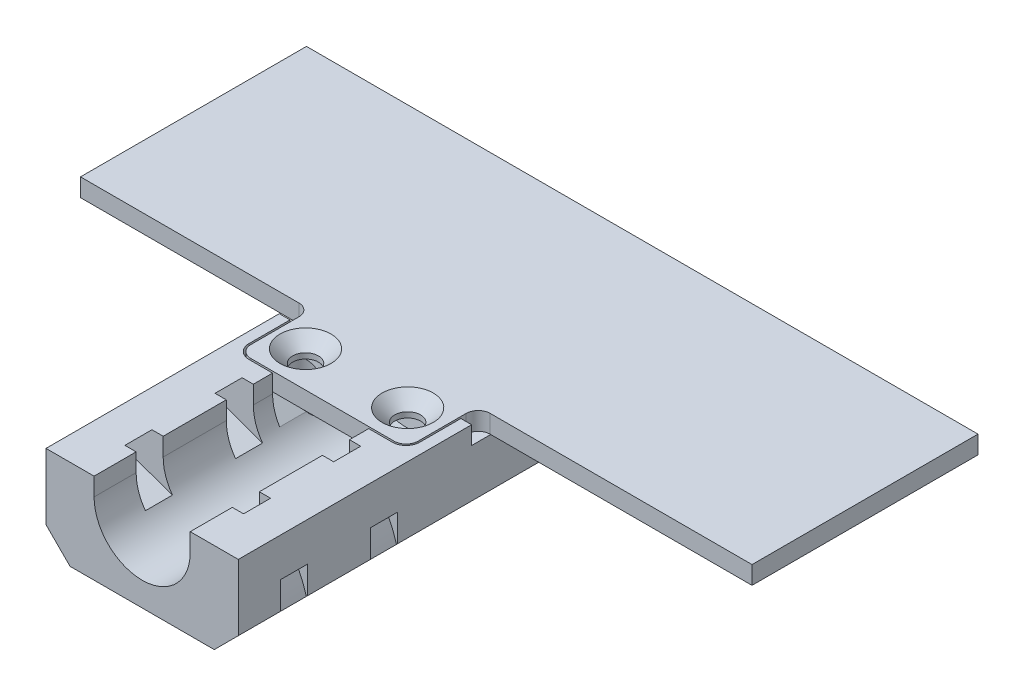
from build123d import *

# Parameters (mm, degrees)
SKETCH1_R                = 2.15
BOSS_EXTRUDE1_DEPTH      = 3
CHAMFER1_SIZE            = 2.1
BOSS_EXTRUDE3_DEPTH      = 30
BOSS_EXTRUDE3_DEPTH_BACK = 12
SKETCH4_R                = 2.65
CUT_EXTRUDE1_DEPTH       = 25
CUT_EXTRUDE2_DEPTH       = 2.8
BOSS_EXTRUDE4_DEPTH      = 3
BOSS_EXTRUDE5_DEPTH      = 12
CHAMFER3_SIZE            = 10
CHAMFER3_SIZE2           = 3.639702343
CUT_EXTRUDE_THIN1_START  = -7
SKETCH9_R                = 18.410976788
SKETCH9_R_2              = 16.410976788
CUT_EXTRUDE_THIN1_DEPTH  = 4.5
CHAMFER4_START           = 34.645648855
CHAMFER4_DEPTH           = 4.5
CUT_EXTRUDE_THIN2_START  = -22
SKETCH9_2_R              = 18.410976788
SKETCH9_2_R_2            = 16.410976788
CUT_EXTRUDE_THIN2_DEPTH  = 4.5
CHAMFER5_START           = 19.645648855
CHAMFER5_DEPTH           = 4.5
CHAMFER6_SIZE            = 8.402490459
CHAMFER6_SIZE_2          = 12
CHAMFER7_SIZE            = 3


with BuildPart() as part:
    # Sketch1 → Boss-Extrude1 (new body)
    with BuildSketch(Plane(origin=(0, 0, 0), x_dir=(1, 0, 0), z_dir=(0, 1, 0))):
        with BuildLine():
            Line((22.073549618, -4.145648855), (65.64480916, -4.145648855))
            Line((65.64480916, -4.145648855), (65.64480916, 33.456717557))
            Line((65.64480916, 33.456717557), (-46.100076336, 33.456717557))
            Line((-46.100076336, 33.456717557), (-46.100076336, -4.145648855))
            Line((-46.100076336, -4.145648855), (-9.756450382, -4.145648855))
            ThreePointArc((-9.756450382, -4.145648855), (-8.342236819, -4.731435293), (-7.756450382, -6.145648855))
            Line((-7.756450382, -6.145648855), (-7.756450382, -14.145648855))
            ThreePointArc((-7.756450382, -14.145648855), (-7.170663944, -15.559862417), (-5.756450382, -16.145648855))
            Line((-5.756450382, -16.145648855), (18.073549618, -16.145648855))
            ThreePointArc((18.073549618, -16.145648855), (19.487763181, -15.559862417), (20.073549618, -14.145648855))
            Line((20.073549618, -14.145648855), (20.073549618, -6.145648855))
            ThreePointArc((20.073549618, -6.145648855), (20.659336056, -4.731435293), (22.073549618, -4.145648855))
        make_face()
        with Locations(Location((14.393549618, -10.195648855, 0), (0, 0, 270))):
            Circle(SKETCH1_R, mode=Mode.SUBTRACT)
        with Locations(Location((-2.606450382, -10.195648855, 0), (0, 0, 270))):
            Circle(SKETCH1_R, mode=Mode.SUBTRACT)
    extrude(amount=BOSS_EXTRUDE1_DEPTH)

    # Chamfer1
    chamfer1_edges = [part.edges().sort_by_distance(p)[0] for p in [
        (14.393549618, 3, 8.045648855),
        (-2.606450382, 3, 8.045648855),
    ]]
    chamfer(chamfer1_edges, length=CHAMFER1_SIZE)


with BuildPart() as body_2:
    # Sketch3 → Boss-Extrude3 (new, two sides: drawn at the far end of the back side and taken through both)
    with BuildSketch(Plane.XY.offset(16.145648855).offset(-BOSS_EXTRUDE3_DEPTH_BACK)):
        with BuildLine():
            Line((-9.841450382, 0), (-1.841450382, 0))
            ThreePointArc((-1.841450382, 0), (6.158549618, -8), (14.158549618, 0))
            Line((14.158549618, 0), (22.158549618, 0))
            Line((22.158549618, 0), (22.158549618, -8))
            Line((22.158549618, -8), (18.158549618, -12))
            Line((18.158549618, -12), (-5.841450382, -12))
            Line((-5.841450382, -12), (-9.841450382, -8))
            Line((-9.841450382, -8), (-9.841450382, 0))
        make_face()
    extrude(amount=BOSS_EXTRUDE3_DEPTH + BOSS_EXTRUDE3_DEPTH_BACK)

    # Sketch4 → Cut-Extrude1 (cut)
    with BuildSketch(Plane(origin=(0, 0, 0), x_dir=(1, 0, 0), z_dir=(0, 1, 0))):
        with Locations(Location((14.393549618, -10.195648855, 0), (0, 0, 264.912370403))):
            Circle(SKETCH4_R)
        with Locations(Location((-2.606450382, -10.195648855, 0), (0, 0, 286.778900879))):
            Circle(SKETCH4_R)
    extrude(amount=-CUT_EXTRUDE1_DEPTH, mode=Mode.SUBTRACT)

    # Sketch5 → Cut-Extrude2 (cut)
    with BuildSketch(Plane.XZ.offset(12)):
        Polygon((14.393549618, 14.32370328), (10.818549618, 12.259676067), (10.818549618, 8.131621643), (14.393549618, 6.06759443), (17.968549618, 8.131621643), (17.968549618, 12.259676067), align=None)
        Polygon((-2.606450382, 14.32370328), (-6.181450382, 12.259676067), (-6.181450382, 8.131621643), (-2.606450382, 6.06759443), (0.968549618, 8.131621643), (0.968549618, 12.259676067), align=None)
    extrude(amount=-CUT_EXTRUDE2_DEPTH, mode=Mode.SUBTRACT)

    # Sketch6 → Boss-Extrude4 (add)
    with BuildSketch(Plane(origin=(0, 0, 0), x_dir=(1, 0, 0), z_dir=(0, 1, 0))):
        with BuildLine():
            Line((14.158549618, -16.445648855), (14.158549618, -46.145648855))
            Line((14.158549618, -46.145648855), (22.158549618, -46.145648855))
            Line((22.158549618, -46.145648855), (22.158549618, -7.32451012))
            Line((22.158549618, -7.32451012), (20.373549618, -7.32451012))
            Line((20.373549618, -7.32451012), (20.373549618, -14.145648855))
            ThreePointArc((20.373549618, -14.145648855), (19.699895215, -15.771994452), (18.073549618, -16.445648855))
            Line((18.073549618, -16.445648855), (14.158549618, -16.445648855))
        make_face()
        with BuildLine():
            Line((-9.841450382, -7.32451012), (-9.841450382, -46.145648855))
            Line((-9.841450382, -46.145648855), (-1.841450382, -46.145648855))
            Line((-1.841450382, -46.145648855), (-1.841450382, -16.445648855))
            Line((-1.841450382, -16.445648855), (-5.756450382, -16.445648855))
            ThreePointArc((-5.756450382, -16.445648855), (-7.382795978, -15.771994452), (-8.056450382, -14.145648855))
            Line((-8.056450382, -14.145648855), (-8.056450382, -7.32451012))
            Line((-8.056450382, -7.32451012), (-9.841450382, -7.32451012))
        make_face()
    extrude(amount=BOSS_EXTRUDE4_DEPTH)

    # Sketch7 → Boss-Extrude5 (add)
    with BuildSketch(Plane(origin=(0, 0, 4.145648855), x_dir=(-1, 0, 0), z_dir=(0, 0, -1))):
        with BuildLine():
            Line((9.841450382, -8), (9.841450382, 0))
            Line((9.841450382, 0), (1.841450382, 0))
            ThreePointArc((1.841450382, 0), (-6.158549618, -8), (-14.158549618, 0))
            Line((-14.158549618, 0), (-22.158549618, 0))
            Line((-22.158549618, 0), (-22.158549618, -8))
            Line((-22.158549618, -8), (-18.158549618, -12))
            Line((-18.158549618, -12), (5.841450382, -12))
            Line((5.841450382, -12), (9.841450382, -8))
        make_face()
    extrude(amount=BOSS_EXTRUDE5_DEPTH)

    # Chamfer3
    chamfer3_edges = [body_2.edges().sort_by_distance(p)[0] for p in [
        (6.158549618, -8, -7.854351145),
    ]]
    chamfer3_side = [body_2.faces().sort_by_distance(p)[0] for p in [
        (6.158549618, -8, 19.145648855),
    ]]
    chamfer(chamfer3_edges, length=CHAMFER3_SIZE, length2=CHAMFER3_SIZE2, reference=chamfer3_side[0])

    # Sketch9 → Cut-Extrude-Thin1 (cut)
    with BuildSketch(Plane.XY.offset(46.145648855).offset(CUT_EXTRUDE_THIN1_START)):
        with Locations((6.158549618, -12.541232702)):
            Circle(SKETCH9_R)
        with Locations((6.158549618, -12.541232702)):
            Circle(SKETCH9_R_2, mode=Mode.SUBTRACT)
    extrude(amount=-CUT_EXTRUDE_THIN1_DEPTH, mode=Mode.SUBTRACT)

    # Chamfer4: read off the stored shape, not the designer's step
    # Chamfer4 outline → Chamfer4 (cut)
    with BuildSketch(Plane.XY.offset(CHAMFER4_START)):
        with BuildLine():
            Line((-6.766645452, -2.428889178), (-0.304047917, -4.715382603))
            ThreePointArc((-0.304047917, -4.715382603), (-1.447394777, -2.479840692), (-1.841450382, 0))
            Line((-1.841450382, 0), (-1.841450382, 1.787764442))
            ThreePointArc((-1.841450382, 1.787764442), (-4.514359504, -0.07491127), (-6.766645452, -2.428889178))
        make_face()
        with BuildLine():
            ThreePointArc((14.158549618, 0), (13.764494013, -2.479840692), (12.621147154, -4.715382603))
            Line((12.621147154, -4.715382603), (19.083744689, -2.428889178))
            ThreePointArc((19.083744689, -2.428889178), (16.83145874, -0.074911271), (14.158549618, 1.787764442))
            Line((14.158549618, 1.787764442), (14.158549618, 0))
        make_face()
    extrude(amount=CHAMFER4_DEPTH, mode=Mode.SUBTRACT)

    # Sketch9<2> → Cut-Extrude-Thin2 (cut)
    with BuildSketch(Plane.XY.offset(46.145648855).offset(CUT_EXTRUDE_THIN2_START)):
        with Locations((6.158549618, -12.541232702)):
            Circle(SKETCH9_2_R)
        with Locations((6.158549618, -12.541232702)):
            Circle(SKETCH9_2_R_2, mode=Mode.SUBTRACT)
    extrude(amount=-CUT_EXTRUDE_THIN2_DEPTH, mode=Mode.SUBTRACT)

    # Chamfer5: read off the stored shape, not the designer's step
    # Chamfer5 outline → Chamfer5 (cut)
    with BuildSketch(Plane.XY.offset(CHAMFER5_START)):
        with BuildLine():
            Line((-6.766645452, -2.428889178), (-0.304047917, -4.715382603))
            ThreePointArc((-0.304047917, -4.715382603), (-1.447394777, -2.479840692), (-1.841450382, 0))
            Line((-1.841450382, 0), (-1.841450382, 1.787764442))
            ThreePointArc((-1.841450382, 1.787764442), (-4.514359504, -0.07491127), (-6.766645452, -2.428889178))
        make_face()
        with BuildLine():
            ThreePointArc((14.158549618, 0), (13.764494013, -2.479840692), (12.621147154, -4.715382603))
            Line((12.621147154, -4.715382603), (19.083744689, -2.428889178))
            ThreePointArc((19.083744689, -2.428889178), (16.83145874, -0.074911271), (14.158549618, 1.787764442))
            Line((14.158549618, 1.787764442), (14.158549618, 0))
        make_face()
    extrude(amount=CHAMFER5_DEPTH, mode=Mode.SUBTRACT)

    # Chamfer6
    # the kernel refuses this chamfer: 12, 8.402490459 mm, written as the material it takes off along each edge
    with BuildSketch(Plane(origin=(-13.192374802, 0, -7.854351145), x_dir=(0, -1, 0), z_dir=(1, 0, 0))) as chamfer6_piece_1:
        Polygon((CHAMFER6_SIZE, 0), (0, -CHAMFER6_SIZE_2), (0, 0), align=None)
    extrude(amount=66.341551184, mode=Mode.SUBTRACT)
    with BuildSketch(Plane(origin=(-40.832077145, 0, -7.854351145), x_dir=(0, 0, 1), z_dir=(1, 0, 0))) as chamfer6_piece_2:
        Polygon((CHAMFER6_SIZE_2, 0), (0, CHAMFER6_SIZE), (0, 0), align=None)
    extrude(amount=66.341551184, mode=Mode.SUBTRACT)

    # Chamfer7
    # the kernel refuses this chamfer: 3 mm, written as the material it takes off along each edge
    with BuildSketch(Plane(origin=(-1.841450382, 0, 16.445648855), x_dir=(-1, 0, 0), z_dir=(0, 0, -1))) as chamfer7_piece_1:
        with BuildLine():
            Line((CHAMFER7_SIZE, 0), (-1.177124344, -4.177124344))
            ThreePointArc((-1.177124344, -4.177124344), (-0.314888309, -2.222399221), (0, 0))
            Line((0, 0), (CHAMFER7_SIZE, 0))
        make_face()
    extrude(amount=14.825043224, mode=Mode.SUBTRACT)
    with BuildSketch(Plane(origin=(-1.841450382, 0, 18.770692079), x_dir=(-1, 0, 0), z_dir=(0, 0, -1))) as chamfer7_piece_2_section:
        with BuildLine():
            Line((CHAMFER7_SIZE, 0), (-1.177124344, -4.177124344))
            ThreePointArc((-1.177124344, -4.177124344), (-0.314888309, -2.222399221), (0, 0))
            Line((0, 0), (CHAMFER7_SIZE, 0))
        make_face()
    chamfer7_piece_2 = extrude(amount=25.737264999, mode=Mode.PRIVATE)
    chamfer7_piece_2 = split(chamfer7_piece_2, bisect_by=Plane(origin=(-1.841450382, 0, 16.445648855), z_dir=(0, 0, -1)), keep=Keep.TOP, mode=Mode.PRIVATE)
    add(chamfer7_piece_2, mode=Mode.SUBTRACT)
    with BuildSketch(Plane(origin=(14.158549618, 0, 18.668311008), x_dir=(-0.2712384034926293, -0.9625121965309165, 0), z_dir=(0, 0, -1))) as chamfer7_piece_3_section:
        with BuildLine():
            Line((4.339814456, 0), (-CHAMFER7_SIZE * 0.271238403493, -CHAMFER7_SIZE * 0.962512196531))
            Line((-CHAMFER7_SIZE * 0.271238403493, -CHAMFER7_SIZE * 0.962512196531), (0, 0))
            ThreePointArc((0, 0), (2.224496158, -0.299716179), (4.339814456, 0))
        make_face()
    chamfer7_piece_3 = extrude(amount=25.634883928, mode=Mode.PRIVATE)
    chamfer7_piece_3 = split(chamfer7_piece_3, bisect_by=Plane(origin=(14.158549618, 0, 16.445648855), z_dir=(0, 0, -1)), keep=Keep.TOP, mode=Mode.PRIVATE)
    add(chamfer7_piece_3, mode=Mode.SUBTRACT)


solid = Compound([part.part, body_2.part])
